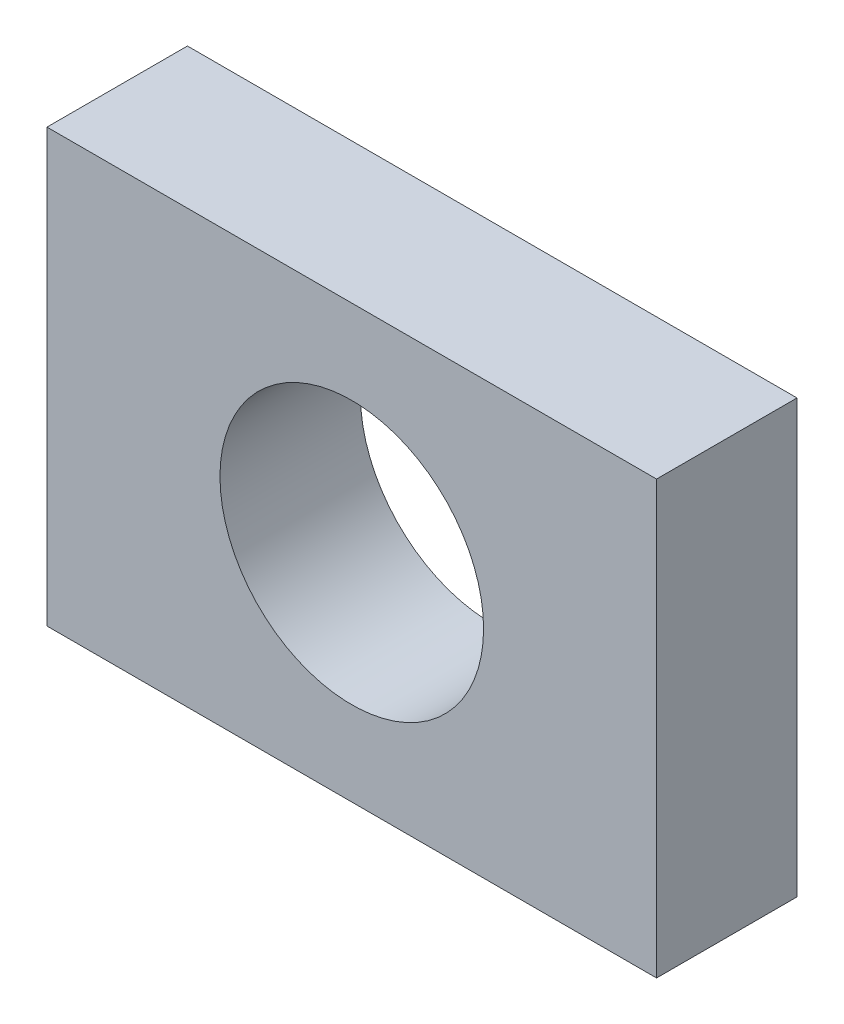
from build123d import *

# Parameters (mm, degrees)
SKETCH1_W           = 110.237040332
SKETCH1_H           = 78.14500721
BOSS_EXTRUDE1_DEPTH = 25.4
SKETCH2_R           = 23.837342091
CUT_EXTRUDE1_DEPTH  = 73.179441694


with BuildPart() as part:
    # Sketch1 → Boss-Extrude1 (new body)
    with BuildSketch(Plane.XY):
        Rectangle(SKETCH1_W, SKETCH1_H)
    extrude(amount=-BOSS_EXTRUDE1_DEPTH)

    # Sketch2 → Cut-Extrude1 (cut, through all)
    with BuildSketch(Plane.XY):
        Circle(SKETCH2_R)
    extrude(amount=-CUT_EXTRUDE1_DEPTH, mode=Mode.SUBTRACT)


solid = part.part
